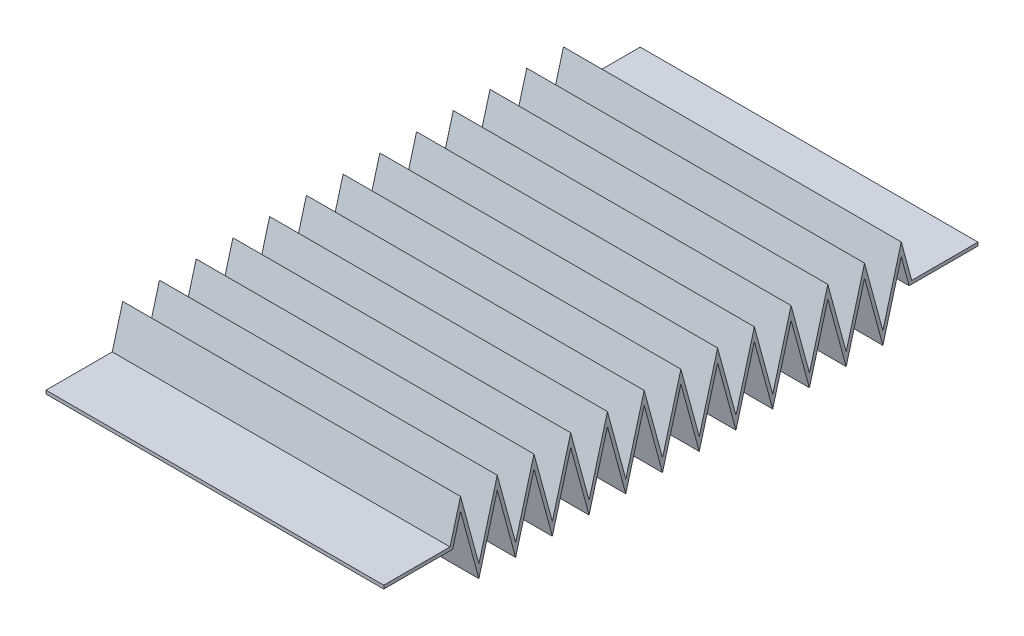
from build123d import *

# Parameters (mm, degrees)
EXTRUDE_THIN1_DEPTH = 25


with BuildPart() as part:
    # Sketch3 → Extrude-Thin1 (new, symmetric)
    with BuildSketch(Plane(origin=(0, 0, 0), x_dir=(0, 0, -1), z_dir=(1, 0, 0))):
        Polygon((0, 4.75), (10.191114307, 4.75), (11.359151069, 9.046935007), (14.077453208, -0.953064993), (16.795755346, 9.046935007), (19.514057485, -0.953064993), (22.232359624, 9.046935007), (24.950661762, -0.953064993), (27.668963901, 9.046935007), (30.387266039, -0.953064993), (33.105568178, 9.046935007), (35.823870316, -0.953064993), (38.542172455, 9.046935007), (41.260474593, -0.953064993), (43.978776732, 9.046935007), (46.697078871, -0.953064993), (49.415381009, 9.046935007), (52.133683148, -0.953064993), (54.851985286, 9.046935007), (57.570287425, -0.953064993), (60.288589563, 9.046935007), (63.006891702, -0.953064993), (65.72519384, 9.046935007), (68.443495979, -0.953064993), (71.161798118, 9.046935007), (73.880100256, -0.953064993), (76.598402395, 9.046935007), (77.766439157, 4.75), (87.957553464, 4.75), (87.957553464, 5.25), (78.148667771, 5.25), (76.598402395, 10.953064993), (73.880100256, 0.953064993), (71.161798118, 10.953064993), (68.443495979, 0.953064993), (65.72519384, 10.953064993), (63.006891702, 0.953064993), (60.288589563, 10.953064993), (57.570287425, 0.953064993), (54.851985286, 10.953064993), (52.133683148, 0.953064993), (49.415381009, 10.953064993), (46.697078871, 0.953064993), (43.978776732, 10.953064993), (41.260474593, 0.953064993), (38.542172455, 10.953064993), (35.823870316, 0.953064993), (33.105568178, 10.953064993), (30.387266039, 0.953064993), (27.668963901, 10.953064993), (24.950661762, 0.953064993), (22.232359624, 10.953064993), (19.514057485, 0.953064993), (16.795755346, 10.953064993), (14.077453208, 0.953064993), (11.359151069, 10.953064993), (9.808885693, 5.25), (0, 5.25), align=None)
    extrude(amount=EXTRUDE_THIN1_DEPTH, both=True)


solid = part.part
